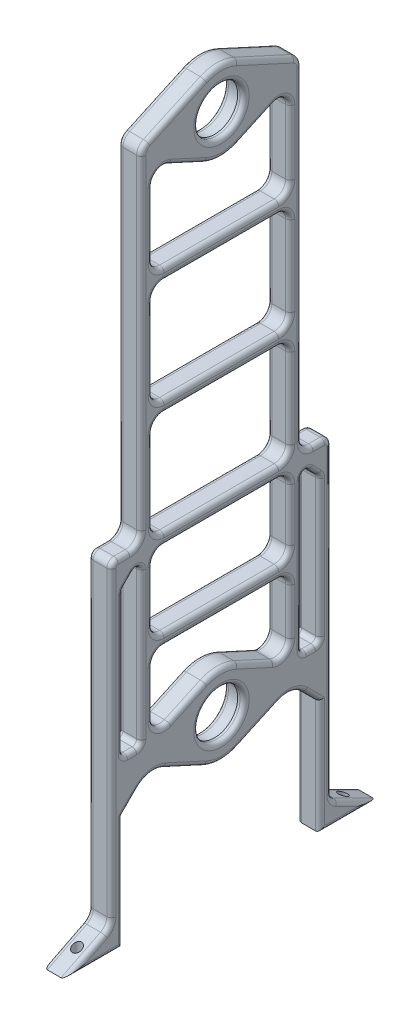
from build123d import *

# Parameters (mm, degrees)
CROQUIS1_W                 = 5
CROQUIS1_H                 = 155
CROQUIS1_W_2               = 60
CROQUIS1_H_2               = 5
CROQUIS1_W_3               = 8
SALIENTE_EXTRUIR1_DEPTH    = 10
SALIENTE_EXTRUIR2_DEPTH    = 10
CORTAR_EXTRUIR5_DEPTH      = 334.282162739
CORTAR_EXTRUIR5_DEPTH_BACK = 334.282162739
MATRIZL2_COUNT             = 2
MATRIZL2_PITCH             = 228
CORTAR_EXTRUIR6_DEPTH      = 334.282162739
CORTAR_EXTRUIR6_DEPTH_BACK = 334.282162739
CROQUIS10_W                = 96
CROQUIS10_H                = 7.219338405
SALIENTE_EXTRUIR4_DEPTH    = 10
CROQUIS12_R                = 2
CORTAR_EXTRUIR7_DEPTH      = 333.811028881
CORTAR_EXTRUIR8_DEPTH      = 340.583568507
CORTAR_EXTRUIR8_DEPTH_BACK = 340.583568507
CROQUIS16_R                = 11.01
CROQUIS17_R                = 11.01
CROQUIS17_R_2              = 10.1
SALIENTE_EXTRUIR5_DEPTH    = 2
SALIENTE_EXTRUIR6_DEPTH    = 10
REDONDEO1_R                = 5
REDONDEO2_R                = 5
REDONDEO3_R                = 2
REDONDEO4_R                = 3
REDONDEO5_R                = 2
REDONDEO6_R                = 5
REDONDEO7_R                = 3
REDONDEO8_R                = 2
REDONDEO9_R                = 2
CROQUIS20_R                = 11.01
CROQUIS20_R_2              = 10.1
SALIENTE_EXTRUIR7_DEPTH    = 1


with BuildPart() as part:
    # Croquis1 → Saliente-Extruir1 (new body)
    with BuildSketch(Plane(origin=(0, 0, 0), x_dir=(0, 0, -1), z_dir=(1, 0, 0))):
        with Locations((2.5, 77.5)):
            Rectangle(CROQUIS1_W, CROQUIS1_H)
        Polygon((22.071067812, 74), (15, 74), (5, 64), (5, 56.928932188), align=None)
        Polygon((5, 74), (15, 74), (22.071067812, 74), (73.928932188, 74), (81, 74), (91, 74), (91, 79), (83, 79), (78, 79), (18, 79), (13, 79), (5, 79), align=None)
        Polygon((91, 64), (91, 56.928932188), (91, 0), (96, 0), (96, 155), (91, 155), (91, 150), (91, 142), (91, 79), (91, 74), align=None)
        Polygon((81, 74), (73.928932188, 74), (91, 56.928932188), (91, 64), align=None)
        Polygon((78, 112), (78, 79), (83, 79), (83, 150), (78, 150), (78, 117), align=None)
        Polygon((13, 150), (13, 79), (18, 79), (18, 112), (18, 117), (18, 150), align=None)
        with Locations((48, 114.5)):
            Rectangle(CROQUIS1_W_2, CROQUIS1_H_2)
        with Locations((9, 152.5)):
            Rectangle(CROQUIS1_W_3, CROQUIS1_H_2)
        with Locations((15.5, 152.5)):
            Rectangle(CROQUIS1_W, CROQUIS1_H_2)
        with Locations((48, 152.5)):
            Rectangle(CROQUIS1_W_2, CROQUIS1_H_2)
        Polygon((13, 305), (13, 155), (18, 155), (18, 200), (18, 205), (18, 250), (18, 255), (18, 300), (18, 305), align=None)
        with Locations((80.5, 152.5)):
            Rectangle(CROQUIS1_W, CROQUIS1_H_2)
        Polygon((78, 200), (78, 155), (83, 155), (83, 305), (78, 305), (78, 300), (78, 255), (78, 250), (78, 205), align=None)
        with Locations((87, 152.5)):
            Rectangle(CROQUIS1_W_3, CROQUIS1_H_2)
        with Locations((48, 302.5)):
            Rectangle(CROQUIS1_W_2, CROQUIS1_H_2)
        with Locations((48, 252.5)):
            Rectangle(CROQUIS1_W_2, CROQUIS1_H_2)
        with Locations((48, 202.5)):
            Rectangle(CROQUIS1_W_2, CROQUIS1_H_2)
        Polygon((5, 150), (5, 142), (13, 150), align=None)
        Polygon((83, 150), (91, 142), (91, 150), align=None)
        Polygon((5, 64), (15, 74), (5, 74), align=None)
        Polygon((91, 74), (81, 74), (91, 64), align=None)
    extrude(amount=SALIENTE_EXTRUIR1_DEPTH)

    # Croquis3 → Saliente-Extruir2 (add)
    with BuildSketch(Plane(origin=(10, 0, 0), x_dir=(0, 0, -1), z_dir=(1, 0, 0))):
        with BuildLine():
            ThreePointArc((55.291666667, 317.408538501), (48, 319), (40.708333333, 317.408538501))
            ThreePointArc((40.708333333, 317.408538501), (34.296056148, 312.38356205), (30.853571801, 305))
            Line((30.853571801, 305), (37.56112554, 305))
            ThreePointArc((37.56112554, 305), (48, 312.51), (58.43887446, 305))
            Line((58.43887446, 305), (65.146428199, 305))
            ThreePointArc((65.146428199, 305), (61.703943852, 312.38356205), (55.291666667, 317.408538501))
        make_face()
        with BuildLine():
            Line((40.708333333, 317.408538501), (15.916666667, 306.045296714))
            ThreePointArc((15.916666667, 306.045296714), (18.908975674, 306.416682136), (21.570714214, 305))
            Line((21.570714214, 305), (30.853571801, 305))
            ThreePointArc((30.853571801, 305), (34.296056148, 312.38356205), (40.708333333, 317.408538501))
        make_face()
        with BuildLine():
            ThreePointArc((21.570714214, 305), (18.908975674, 306.416682136), (15.916666667, 306.045296714))
            ThreePointArc((15.916666667, 306.045296714), (15.125069614, 305.590815967), (14.429285786, 305))
            Line((14.429285786, 305), (21.570714214, 305))
        make_face()
        with BuildLine():
            Line((21.570714214, 305), (14.429285786, 305))
            ThreePointArc((14.429285786, 305), (13.371092404, 303.390294809), (13, 301.5))
            ThreePointArc((13, 301.5), (13.791872942, 298.799691376), (15.916666667, 296.954703286))
            ThreePointArc((15.916666667, 296.954703286), (16.933811361, 296.614998282), (18, 296.5))
            Line((18, 296.5), (18, 300))
            Line((18, 300), (22.769696007, 300))
            ThreePointArc((22.769696007, 300), (22.942088629, 300.741211504), (23, 301.5))
            ThreePointArc((23, 301.5), (22.628907596, 303.390294809), (21.570714214, 305))
        make_face()
        with BuildLine():
            ThreePointArc((18, 296.5), (20.958039892, 297.468871126), (22.769696007, 300))
            Line((22.769696007, 300), (18, 300))
            Line((18, 300), (18, 296.5))
        make_face()
        with BuildLine():
            ThreePointArc((40.708333333, 285.591461499), (33.690532072, 291.425818762), (30.564404226, 300))
            Line((30.564404226, 300), (22.769696007, 300))
            ThreePointArc((22.769696007, 300), (20.958039892, 297.468871126), (18, 296.5))
            Line((18, 296.5), (18, 295.999809018))
            Line((18, 295.999809018), (40.708333333, 285.591461499))
        make_face()
        with BuildLine():
            Line((37.092658436, 300), (30.564404226, 300))
            ThreePointArc((30.564404226, 300), (33.690532072, 291.425818762), (40.708333333, 285.591461499))
            ThreePointArc((40.708333333, 285.591461499), (48, 284), (55.291666667, 285.591461499))
            ThreePointArc((55.291666667, 285.591461499), (62.309467928, 291.425818762), (65.435595774, 300))
            Line((65.435595774, 300), (58.907341564, 300))
            ThreePointArc((58.907341564, 300), (48, 290.49), (37.092658436, 300))
        make_face()
        with BuildLine():
            ThreePointArc((78, 296.5), (75.041960108, 297.468871126), (73.230303993, 300))
            Line((73.230303993, 300), (65.435595774, 300))
            ThreePointArc((65.435595774, 300), (62.309467928, 291.425818762), (55.291666667, 285.591461499))
            Line((55.291666667, 285.591461499), (78, 295.999809018))
            Line((78, 295.999809018), (78, 296.5))
        make_face()
        with BuildLine():
            Line((80.083333333, 306.045296714), (55.291666667, 317.408538501))
            ThreePointArc((55.291666667, 317.408538501), (61.703943852, 312.38356205), (65.146428199, 305))
            Line((65.146428199, 305), (74.429285786, 305))
            ThreePointArc((74.429285786, 305), (77.091024326, 306.416682136), (80.083333333, 306.045296714))
        make_face()
        with BuildLine():
            Line((30.853571801, 305), (21.570714214, 305))
            ThreePointArc((21.570714214, 305), (22.628907596, 303.390294809), (23, 301.5))
            ThreePointArc((23, 301.5), (22.942088629, 300.741211504), (22.769696007, 300))
            Line((22.769696007, 300), (30.564404226, 300))
            ThreePointArc((30.564404226, 300), (30.529193049, 302.510398175), (30.853571801, 305))
        make_face()
        with BuildLine():
            Line((37.56112554, 305), (30.853571801, 305))
            ThreePointArc((30.853571801, 305), (30.529193049, 302.510398175), (30.564404226, 300))
            Line((30.564404226, 300), (37.092658436, 300))
            ThreePointArc((37.092658436, 300), (37.038009549, 302.527066384), (37.56112554, 305))
        make_face()
        with BuildLine():
            ThreePointArc((65.5, 301.5), (65.411382678, 303.258906835), (65.146428199, 305))
            Line((65.146428199, 305), (58.43887446, 305))
            ThreePointArc((58.43887446, 305), (58.866280592, 303.273145819), (59.01, 301.5))
            ThreePointArc((59.01, 301.5), (58.984305409, 300.748245593), (58.907341564, 300))
            Line((58.907341564, 300), (65.435595774, 300))
            ThreePointArc((65.435595774, 300), (65.48389153, 300.749309001), (65.5, 301.5))
        make_face()
        with BuildLine():
            Line((74.429285786, 305), (65.146428199, 305))
            ThreePointArc((65.146428199, 305), (65.411382678, 303.258906835), (65.5, 301.5))
            ThreePointArc((65.5, 301.5), (65.48389153, 300.749309001), (65.435595774, 300))
            Line((65.435595774, 300), (73.230303993, 300))
            ThreePointArc((73.230303993, 300), (73.137838889, 302.665928529), (74.429285786, 305))
        make_face()
        with BuildLine():
            Line((78, 300), (73.230303993, 300))
            ThreePointArc((73.230303993, 300), (75.041960108, 297.468871126), (78, 296.5))
            Line((78, 296.5), (78, 300))
        make_face()
        with BuildLine():
            ThreePointArc((83, 301.5), (82.628907596, 303.390294809), (81.570714214, 305))
            Line((81.570714214, 305), (74.429285786, 305))
            ThreePointArc((74.429285786, 305), (73.137838889, 302.665928529), (73.230303993, 300))
            Line((73.230303993, 300), (78, 300))
            Line((78, 300), (78, 296.5))
            ThreePointArc((78, 296.5), (79.066188639, 296.614998282), (80.083333333, 296.954703286))
            ThreePointArc((80.083333333, 296.954703286), (82.208127058, 298.799691376), (83, 301.5))
        make_face()
        with BuildLine():
            ThreePointArc((81.570714214, 305), (80.874930386, 305.590815967), (80.083333333, 306.045296714))
            ThreePointArc((80.083333333, 306.045296714), (77.091024326, 306.416682136), (74.429285786, 305))
            Line((74.429285786, 305), (81.570714214, 305))
        make_face()
    saliente_extruir2 = extrude(amount=-SALIENTE_EXTRUIR2_DEPTH)

    # Croquis7 → Cortar-Extruir5 (cut, two sides: drawn at the far end of the back side and taken through both)
    with BuildSketch(Plane(origin=(10, 0, 0), x_dir=(0, 0, -1), z_dir=(1, 0, 0)).offset(-CORTAR_EXTRUIR5_DEPTH_BACK)):
        with BuildLine():
            Line((83, 305), (81.570714214, 305))
            ThreePointArc((81.570714214, 305), (82.628907596, 303.390294809), (83, 301.5))
            Line((83, 301.5), (83, 305))
        make_face()
        with BuildLine():
            ThreePointArc((13, 301.5), (13.371092404, 303.390294809), (14.429285786, 305))
            Line((14.429285786, 305), (13, 305))
            Line((13, 305), (13, 301.5))
        make_face()
    extrude(amount=CORTAR_EXTRUIR5_DEPTH + CORTAR_EXTRUIR5_DEPTH_BACK, mode=Mode.SUBTRACT)

    # MatrizL2: Saliente-Extruir2 ×2
    with Locations(*[(0, -i * MATRIZL2_PITCH, 0) for i in range(1, MATRIZL2_COUNT)]):
        add(saliente_extruir2)

    # Croquis10 → Cortar-Extruir6 (cut, two sides: drawn at the far end of the back side and taken through both)
    with BuildSketch(Plane(origin=(10, 0, 0), x_dir=(0, 0, -1), z_dir=(1, 0, 0)).offset(-CORTAR_EXTRUIR6_DEPTH_BACK)):
        with Locations((48, 3.609669203)):
            Rectangle(CROQUIS10_W, CROQUIS10_H)
    extrude(amount=CORTAR_EXTRUIR6_DEPTH + CORTAR_EXTRUIR6_DEPTH_BACK, mode=Mode.SUBTRACT)

    # Croquis11 → Saliente-Extruir4 (add)
    with BuildSketch(Plane(origin=(10, 0, 0), x_dir=(0, 0, -1), z_dir=(1, 0, 0))):
        Polygon((0, 17.219338405), (0, 7.219338405), (-20, 7.219338405), align=None)
        Polygon((96, 7.219338405), (116, 7.219338405), (96, 17.219338405), align=None)
    extrude(amount=-SALIENTE_EXTRUIR4_DEPTH)

    # Croquis12 → Cortar-Extruir7 (cut, symmetric)
    with BuildSketch(Plane.XZ.offset(-7.219338405)):
        with Locations(Location((5, 10, 0), (0, 0, 90))):
            Circle(CROQUIS12_R)
    cortar_extruir7 = extrude(amount=CORTAR_EXTRUIR7_DEPTH, both=True, mode=Mode.SUBTRACT)

    # Simetría1: Cortar-Extruir7 across plane
    add(cortar_extruir7.mirror(Plane.XY.offset(-48)), mode=Mode.SUBTRACT)

    # Croquis16 → Cortar-Extruir8 (cut, two sides: drawn at the far end of the back side and taken through both)
    with BuildSketch(Plane.ZY.offset(-CORTAR_EXTRUIR8_DEPTH_BACK)):
        with Locations(Location((-48, 301.5, 0), (0, 0, 180))):
            Circle(CROQUIS16_R)
        with Locations(Location((-48, 73.5, 0), (0, 0, 180))):
            Circle(CROQUIS16_R)
    extrude(amount=CORTAR_EXTRUIR8_DEPTH + CORTAR_EXTRUIR8_DEPTH_BACK, mode=Mode.SUBTRACT)

    # Croquis17 → Saliente-Extruir5 (add)
    # profile 1 of 2: a face of its own
    with BuildSketch(Plane(origin=(10, 0, 0), x_dir=(0, 0, -1), z_dir=(1, 0, 0))):
        with Locations((48, 301.5)):
            Circle(CROQUIS17_R)
        with Locations((48, 301.5)):
            Circle(CROQUIS17_R_2, mode=Mode.SUBTRACT)
    # profile 2 of 2: a face of its own
    with BuildSketch(Plane(origin=(10, 0, 0), x_dir=(0, 0, -1), z_dir=(1, 0, 0))):
        with Locations((48, 73.5)):
            Circle(CROQUIS17_R)
        with Locations((48, 73.5)):
            Circle(CROQUIS17_R_2, mode=Mode.SUBTRACT)
    extrude(amount=-SALIENTE_EXTRUIR5_DEPTH)

    # Croquis18 → Saliente-Extruir6 (add)
    with BuildSketch(Plane(origin=(10, 0, 0), x_dir=(0, 0, -1), z_dir=(1, 0, 0))):
        with BuildLine():
            ThreePointArc((25.083333314, 82.246831483), (20.299691366, 82.584001155), (18, 86.792128207))
            Line((18, 86.792128207), (18, 79.000190982))
            Line((18, 79.000190982), (25.083333314, 82.246831483))
        make_face()
        with BuildLine():
            Line((16.733998445, 68.662930633), (11.760441157, 63.689373345))
            ThreePointArc((11.760441157, 63.689373345), (17.062750051, 66.460637167), (22.998175284, 65.708899133))
            Line((22.998175284, 65.708899133), (18, 67.999809018))
            Line((18, 67.999809018), (18, 68.5))
            ThreePointArc((18, 68.5), (17.361778579, 68.540899939), (16.733998445, 68.662930633))
        make_face()
        with BuildLine():
            ThreePointArc((73.001824589, 65.708899074), (78.937249912, 66.460637174), (84.239558888, 63.6893733))
            Line((84.239558888, 63.6893733), (79.266001555, 68.662930633))
            ThreePointArc((79.266001555, 68.662930633), (78.638221421, 68.540899939), (78, 68.5))
            Line((78, 68.5), (78, 67.999809018))
            Line((78, 67.999809018), (73.001824589, 65.708899074))
        make_face()
        with BuildLine():
            Line((70.916667391, 82.24683116), (78, 79.000190982))
            Line((78, 79.000190982), (78, 86.792128207))
            ThreePointArc((78, 86.792128207), (75.70030896, 82.584001365), (70.916667391, 82.24683116))
        make_face()
        with BuildLine():
            ThreePointArc((70.916666776, 292.753168558), (75.700308675, 292.415998818), (78, 288.207871793))
            Line((78, 288.207871793), (78, 295.999809018))
            Line((78, 295.999809018), (70.916666776, 292.753168558))
        make_face()
        with BuildLine():
            Line((25.083333342, 292.753168503), (18, 295.999809018))
            Line((18, 295.999809018), (18, 288.207871793))
            ThreePointArc((18, 288.207871793), (20.29969138, 292.415998853), (25.083333342, 292.753168503))
        make_face()
    extrude(amount=-SALIENTE_EXTRUIR6_DEPTH)

    # Redondeo1
    redondeo1_edges = [part.edges().sort_by_distance(p)[0] for p in [
        (5, 112, -18),
        (5, 112, -78),
        (5, 150, -18),
        (5, 117, -18),
        (5, 117, -78),
        (5, 150, -78),
        (5, 200, -78),
        (5, 200, -18),
        (5, 155, -18),
        (5, 155, -78),
        (5, 255, -18),
        (5, 255, -78),
        (5, 250, -78),
        (5, 250, -18),
        (5, 205, -18),
        (5, 205, -78),
    ]]
    fillet(redondeo1_edges, radius=REDONDEO1_R)

    # Redondeo2
    redondeo2_edges = [part.edges().sort_by_distance(p)[0] for p in [
        (5, 17.219338405, 0),
        (5, 17.219338405, -96),
    ]]
    fillet(redondeo2_edges, radius=REDONDEO2_R)

    # Redondeo3
    redondeo3_edges = [part.edges().sort_by_distance(p)[0] for p in [
        (5, 79, -5),
        (5, 79, -13),
        (5, 79, -83),
        (5, 79, -91),
    ]]
    fillet(redondeo3_edges, radius=REDONDEO3_R)

    # Redondeo4
    redondeo4_edges = [part.edges().sort_by_distance(p)[0] for p in [
        (5, 142, -5),
        (5, 142, -91),
    ]]
    fillet(redondeo4_edges, radius=REDONDEO4_R)

    # Redondeo5
    redondeo5_edges = [part.edges().sort_by_distance(p)[0] for p in [
        (5, 150, -13),
        (5, 150, -83),
    ]]
    fillet(redondeo5_edges, radius=REDONDEO5_R)

    # Redondeo6
    redondeo6_edges = [part.edges().sort_by_distance(p)[0] for p in [
        (5, 155, -83),
        (5, 155, -13),
    ]]
    fillet(redondeo6_edges, radius=REDONDEO6_R)

    # Redondeo7
    redondeo7_edges = [part.edges().sort_by_distance(p)[0] for p in [
        (5, 155, -96),
        (5, 155, 0),
    ]]
    fillet(redondeo7_edges, radius=REDONDEO7_R)

    # Redondeo8
    redondeo8_edges = [part.edges().sort_by_distance(p)[0] for p in [
        (0, 110.878679656, -5),
        (0, 79.585786438, -83.585786438),
        (0, 79.585786438, -90.414213562),
        (0, 79.585786438, -12.414213562),
        (0, 79.585786438, -5.585786438),
        (0, 110.878679656, -91),
        (0, 141.90540961, -90.771638598),
        (0, 141.90540961, -5.228361402),
        (0, 144.732233047, -88.267766953),
        (0, 113.085786438, -13),
        (0, 144.732233047, -7.732233047),
        (0, 147.01933194, -84.234633135),
        (0, 147.01933194, -11.765366865),
        (0, 230.75, -83),
        (0, 155, -90.5),
        (0, 156.464466094, -84.464466094),
        (0, 156.464466094, -11.535533906),
        (0, 155, -5.5),
        (0, 86.154754174, -96),
        (0, 154.121320344, -0.878679656),
        (0, 154.121320344, -95.121320344),
        (0, 304.200308624, -13.791872942),
        (0, 319, -48),
        (0, 311.726917607, -67.6875),
        (0, 304.200308624, -82.208127058),
        (0, 303.273145819, -58.866280592),
        (0, 311.726917607, -28.3125),
        (0, 289.172315029, -63.104166721),
        (0, 284, -48),
        (0, 289.172315001, -32.895833338),
        (0, 230.75, -13),
        (0, 73.750064507, -59.00715984),
        (0, 56, -48),
        (0, 61.650180316, -31.853254309),
        (0, 85.827684992, -32.895833323),
        (0, 61.650180287, -64.146745628),
        (0, 91, -48),
        (0, 85.82768483, -63.104167029),
        (0, 32.074135296, -5),
        (0, 7.219338405, 7.5),
        (0, 7.219338405, -103.5),
        (0, 82.584001155, -20.299691366),
        (0, 60.309152767, -8.380220579),
        (0, 66.460637167, -17.062750051),
        (0, 60.309152744, -87.619779444),
        (0, 66.460637174, -78.937249912),
        (0, 96.896064103, -78),
        (0, 82.584001365, -75.70030896),
        (0, 292.415998818, -75.700308675),
        (0, 274.103935897, -18),
        (0, 292.415998853, -20.29969138),
        (0, 227.5, -78),
        (0, 250, -48),
        (0, 177.5, -78),
        (0, 200, -48),
        (0, 133.5, -78),
        (0, 150, -48),
        (0, 112, -48),
        (0, 96.896064103, -18),
        (0, 133.5, -18),
        (0, 177.5, -18),
        (0, 227.5, -18),
        (0, 117, -48),
        (0, 155, -48),
        (0, 205, -48),
        (0, 255, -48),
        (0, 274.103935897, -78),
        (0, 248.535533906, -76.535533906),
        (0, 32.074135296, -91),
        (0, 198.535533906, -76.535533906),
        (0, 148.535533906, -76.535533906),
        (0, 110.535533906, -76.535533906),
        (0, 110.535533906, -19.464466094),
        (0, 148.535533906, -19.464466094),
        (0, 198.535533906, -19.464466094),
        (0, 248.535533906, -19.464466094),
        (0, 118.464466094, -19.464466094),
        (0, 118.464466094, -76.535533906),
        (0, 156.464466094, -76.535533906),
        (0, 156.464466094, -19.464466094),
        (0, 206.464466094, -19.464466094),
        (0, 256.464466094, -76.535533906),
        (0, 206.464466094, -76.535533906),
        (0, 256.464466094, -19.464466094),
        (0, 11.528355399, -107.381966011),
        (0, 86.154754174, 0),
        (0, 11.528355399, 11.381966011),
        (0, 17.680852788, -96.746745958),
        (0, 17.680852788, 0.746745958),
        (0, 113.085786438, -83),
        (0, 79, -87),
        (0, 79, -9),
    ]]
    fillet(redondeo8_edges, radius=REDONDEO8_R)

    # Redondeo9
    redondeo9_edges = [part.edges().sort_by_distance(p)[0] for p in [
        (10, 110.878679656, -5),
        (10, 79.585786438, -83.585786438),
        (10, 79.585786438, -90.414213562),
        (10, 79.585786438, -12.414213562),
        (10, 79.585786438, -5.585786438),
        (10, 110.878679656, -91),
        (10, 141.90540961, -90.771638598),
        (10, 141.90540961, -5.228361402),
        (10, 144.732233047, -88.267766953),
        (10, 113.085786438, -13),
        (10, 144.732233047, -7.732233047),
        (10, 147.01933194, -84.234633135),
        (10, 147.01933194, -11.765366865),
        (10, 230.75, -83),
        (10, 155, -90.5),
        (10, 32.074135296, -91),
        (10, 156.464466094, -84.464466094),
        (10, 156.464466094, -11.535533906),
        (10, 86.154754174, -96),
        (10, 155, -5.5),
        (10, 154.121320344, -0.878679656),
        (10, 154.121320344, -95.121320344),
        (10, 304.200308624, -13.791872942),
        (10, 304.200308624, -82.208127058),
        (10, 311.726917607, -67.6875),
        (10, 319, -48),
        (10, 311.726917607, -28.3125),
        (10, 284, -48),
        (10, 230.75, -13),
        (10, 56, -48),
        (10, 91, -48),
        (10, 32.074135296, -5),
        (10, 7.219338405, 7.5),
        (10, 7.219338405, -103.5),
        (10, 11.528355399, 11.381966011),
        (10, 11.528355399, -107.381966011),
        (10, 301.5, -37.9),
        (10, 73.5, -37.9),
        (10, 85.827684992, -32.895833323),
        (10, 82.584001155, -20.299691366),
        (10, 61.650180316, -31.853254309),
        (10, 60.309152767, -8.380220579),
        (10, 66.460637167, -17.062750051),
        (10, 61.650180287, -64.146745628),
        (10, 60.309152744, -87.619779444),
        (10, 66.460637174, -78.937249912),
        (10, 85.82768483, -63.104167029),
        (10, 96.896064103, -78),
        (10, 82.584001365, -75.70030896),
        (10, 289.172315029, -63.104166721),
        (10, 292.415998818, -75.700308675),
        (10, 289.172315001, -32.895833338),
        (10, 274.103935897, -18),
        (10, 292.415998853, -20.29969138),
        (10, 227.5, -78),
        (10, 250, -48),
        (10, 177.5, -78),
        (10, 200, -48),
        (10, 133.5, -78),
        (10, 150, -48),
        (10, 112, -48),
        (10, 96.896064103, -18),
        (10, 133.5, -18),
        (10, 177.5, -18),
        (10, 227.5, -18),
        (10, 117, -48),
        (10, 155, -48),
        (10, 205, -48),
        (10, 255, -48),
        (10, 274.103935897, -78),
        (10, 248.535533906, -76.535533906),
        (10, 198.535533906, -76.535533906),
        (10, 148.535533906, -76.535533906),
        (10, 110.535533906, -76.535533906),
        (10, 110.535533906, -19.464466094),
        (10, 148.535533906, -19.464466094),
        (10, 198.535533906, -19.464466094),
        (10, 248.535533906, -19.464466094),
        (10, 118.464466094, -19.464466094),
        (10, 118.464466094, -76.535533906),
        (10, 156.464466094, -76.535533906),
        (10, 156.464466094, -19.464466094),
        (10, 206.464466094, -19.464466094),
        (10, 256.464466094, -76.535533906),
        (10, 206.464466094, -76.535533906),
        (10, 256.464466094, -19.464466094),
        (10, 86.154754174, 0),
        (10, 17.680852788, -96.746745958),
        (10, 17.680852788, 0.746745958),
        (10, 113.085786438, -83),
        (10, 79, -87),
        (10, 79, -9),
    ]]
    fillet(redondeo9_edges, radius=REDONDEO9_R - 0.0001)  # a hair under: the kernel refuses the full size

    # Croquis20 → Saliente-Extruir7 (add)
    # profile 1 of 2: a face of its own
    with BuildSketch(Plane.ZY.offset(-8)):
        with Locations(Location((-48, 73.5, 0), (0, 0, 180))):
            Circle(CROQUIS20_R)
        with Locations(Location((-48, 73.5, 0), (0, 0, 180))):
            Circle(CROQUIS20_R_2, mode=Mode.SUBTRACT)
    # profile 2 of 2: a face of its own
    with BuildSketch(Plane.ZY.offset(-8)):
        with Locations(Location((-48, 301.5, 0), (0, 0, 180))):
            Circle(CROQUIS20_R)
        with Locations(Location((-48, 301.5, 0), (0, 0, 180))):
            Circle(CROQUIS20_R_2, mode=Mode.SUBTRACT)
    extrude(amount=SALIENTE_EXTRUIR7_DEPTH)


solid = part.part
